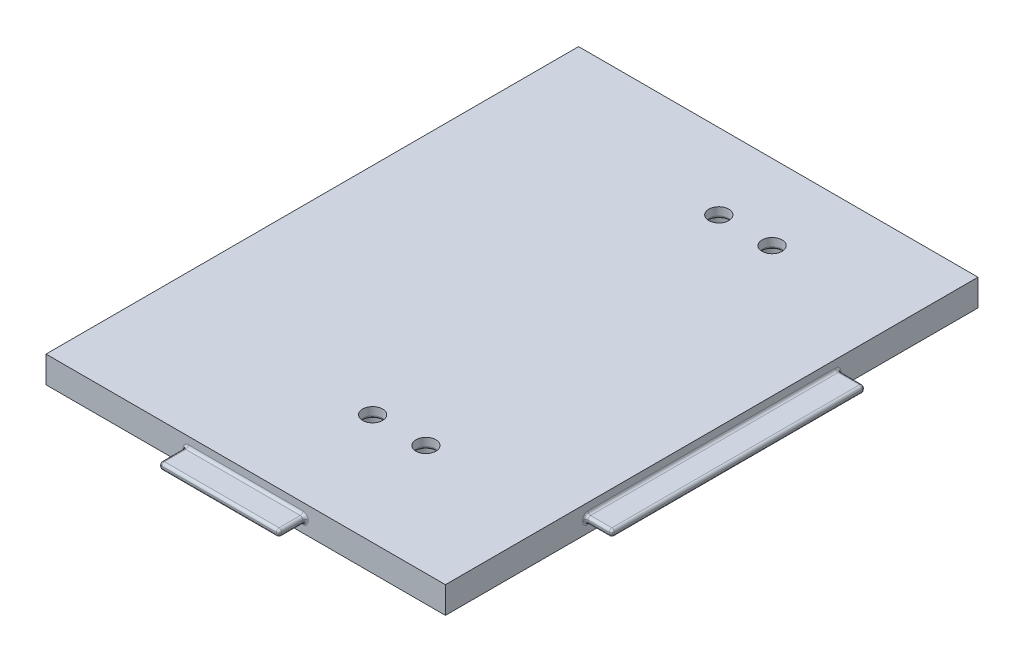
from build123d import *

# Parameters (mm, degrees)
SKETCH1_W           = 150
SKETCH1_H           = 200
BOSS_EXTRUDE1_DEPTH = 10
SKETCH2_W           = 100
SKETCH2_H           = 3
CUT_EXTRUDE1_DEPTH  = 10
CHAMFER1_SIZE       = 10
SKETCH3_W           = 50
SKETCH3_H           = 3
CUT_EXTRUDE2_DEPTH  = 10
CHAMFER2_SIZE       = 10
FILLET1_R           = 1
SKETCH4_W           = 45
SKETCH4_H           = 2.5
BOSS_EXTRUDE2_DEPTH = 10
SKETCH5_W           = 95
SKETCH5_H           = 2.5
BOSS_EXTRUDE3_DEPTH = 10
FILLET2_R           = 1
SKETCH6_R           = 3.75
CUT_EXTRUDE3_DEPTH  = 10
SKETCH7_R           = 5
CUT_EXTRUDE4_DEPTH  = 6
FILLET3_R           = 1


# Some blends are built 0.0001 mm under size
with BuildPart() as part:
    # Sketch1 → Boss-Extrude1 (new body)
    with BuildSketch(Plane(origin=(0, 0, 0), x_dir=(1, 0, 0), z_dir=(0, 1, 0))):
        Rectangle(SKETCH1_W, SKETCH1_H)
    extrude(amount=BOSS_EXTRUDE1_DEPTH)

    # Sketch2 → Cut-Extrude1 (cut)
    with BuildSketch(Plane.ZY.offset(75)):
        with Locations((0, 5)):
            Rectangle(SKETCH2_W, SKETCH2_H)
    extrude(amount=-CUT_EXTRUDE1_DEPTH, mode=Mode.SUBTRACT)

    # Chamfer1
    chamfer1_edges = [part.edges().sort_by_distance(p)[0] for p in [
        (-75, 5, 50),
        (-75, 5, -50),
    ]]
    chamfer(chamfer1_edges, length=CHAMFER1_SIZE - 0.0001)  # a hair under: the kernel refuses the full size

    # Sketch3 → Cut-Extrude2 (cut)
    with BuildSketch(Plane(origin=(0, 0, -100), x_dir=(-1, 0, 0), z_dir=(0, 0, -1))):
        with Locations((0, 5)):
            Rectangle(SKETCH3_W, SKETCH3_H)
    extrude(amount=-CUT_EXTRUDE2_DEPTH, mode=Mode.SUBTRACT)

    # Chamfer2
    chamfer2_edges = [part.edges().sort_by_distance(p)[0] for p in [
        (-25, 5, -100),
        (25, 5, -100),
    ]]
    chamfer(chamfer2_edges, length=CHAMFER2_SIZE - 0.0001)  # a hair under: the kernel refuses the full size

    # Fillet1
    # the kernel refuses this fillet: 1 mm, written as the material it adds along each edge
    with BuildSketch(Plane(origin=(-65, 6.5, 52.5), x_dir=(0, -1, 0), z_dir=(0, 0, -1)), Plane(origin=(-65, 3.5, -52.5), x_dir=(0, 1, 0), z_dir=(0, 0, 1))) as fillet1_piece_1:
        with BuildLine():
            CenterArc((FILLET1_R, FILLET1_R), FILLET1_R, 180, 90)
            Line((0, FILLET1_R), (0, 0))
            Line((0, 0), (FILLET1_R, 0))
        make_face()
    extrude(amount=105)
    with BuildSketch(Plane(origin=(-76.767766953, 6.5, 61.767666953), x_dir=(-0.7071067811865476, 0, -0.7071067811865476), z_dir=(0.7071067811865476, 0, -0.7071067811865476))) as fillet1_piece_2_section:
        with BuildLine():
            CenterArc((FILLET1_R, -FILLET1_R), FILLET1_R, 90, 90)
            Line((0, -FILLET1_R), (0, 0))
            Line((0, 0), (FILLET1_R, 0))
        make_face()
    fillet1_piece_2 = extrude(amount=19.141994202, mode=Mode.PRIVATE)
    fillet1_piece_2 = split(fillet1_piece_2, bisect_by=Plane(origin=(-75, 6.269593446, 54.844665919), z_dir=(1, 0, 0)), keep=Keep.TOP, mode=Mode.PRIVATE)
    add(fillet1_piece_2)
    with BuildSketch(Plane(origin=(-76.767766953, 3.5, 61.767666953), x_dir=(0, 1, 0), z_dir=(0.7071067811865476, 0, -0.7071067811865476))) as fillet1_piece_3_section:
        with BuildLine():
            CenterArc((FILLET1_R, -FILLET1_R), FILLET1_R, 90, 90)
            Line((0, -FILLET1_R), (0, 0))
            Line((0, 0), (FILLET1_R, 0))
        make_face()
    fillet1_piece_3 = extrude(amount=19.141994202, mode=Mode.PRIVATE)
    fillet1_piece_3 = split(fillet1_piece_3, bisect_by=Plane(origin=(-75, 3.730406554, 54.844665919), z_dir=(1, 0, 0)), keep=Keep.TOP, mode=Mode.PRIVATE)
    add(fillet1_piece_3)
    with BuildSketch(Plane(origin=(-76.767766953, 3.5, -61.767666953), x_dir=(0, 1, 0), z_dir=(0.7071067811865476, 0, 0.7071067811865476))) as fillet1_piece_4_section:
        with BuildLine():
            CenterArc((FILLET1_R, FILLET1_R), FILLET1_R, 180, 90)
            Line((0, FILLET1_R), (0, 0))
            Line((0, 0), (FILLET1_R, 0))
        make_face()
    fillet1_piece_4 = extrude(amount=19.141994202, mode=Mode.PRIVATE)
    fillet1_piece_4 = split(fillet1_piece_4, bisect_by=Plane(origin=(-75, 3.730406554, -54.844665919), z_dir=(1, 0, 0)), keep=Keep.TOP, mode=Mode.PRIVATE)
    add(fillet1_piece_4)
    with BuildSketch(Plane(origin=(-76.767766953, 6.5, -61.767666953), x_dir=(0, -1, 0), z_dir=(0.7071067811865476, 0, 0.7071067811865476))) as fillet1_piece_5_section:
        with BuildLine():
            CenterArc((FILLET1_R, -FILLET1_R), FILLET1_R, 90, 90)
            Line((0, -FILLET1_R), (0, 0))
            Line((0, 0), (FILLET1_R, 0))
        make_face()
    fillet1_piece_5 = extrude(amount=19.141994202, mode=Mode.PRIVATE)
    fillet1_piece_5 = split(fillet1_piece_5, bisect_by=Plane(origin=(-75, 6.269593446, -54.844665919), z_dir=(1, 0, 0)), keep=Keep.TOP, mode=Mode.PRIVATE)
    add(fillet1_piece_5)
    with BuildSketch(Plane(origin=(-27.5, 6.5, -90), x_dir=(0, -1, 0), z_dir=(1, 0, 0)), Plane(origin=(27.5, 3.5, -90), x_dir=(0, 1, 0), z_dir=(-1, 0, 0))) as fillet1_piece_6:
        with BuildLine():
            CenterArc((FILLET1_R, FILLET1_R), FILLET1_R, 180, 90)
            Line((0, FILLET1_R), (0, 0))
            Line((0, 0), (FILLET1_R, 0))
        make_face()
    extrude(amount=55)
    with BuildSketch(Plane(origin=(-36.767666953, 6.5, -101.767766953), x_dir=(0.7071067811865475, 0, -0.7071067811865477), z_dir=(0.7071067811865477, 0, 0.7071067811865474))) as fillet1_piece_7_section:
        with BuildLine():
            CenterArc((FILLET1_R, -FILLET1_R), FILLET1_R, 90, 90)
            Line((0, -FILLET1_R), (0, 0))
            Line((0, 0), (FILLET1_R, 0))
        make_face()
    fillet1_piece_7 = extrude(amount=19.141994202, mode=Mode.PRIVATE)
    fillet1_piece_7 = split(fillet1_piece_7, bisect_by=Plane(origin=(-29.844665919, 6.269593446, -100), z_dir=(0, 0, 1)), keep=Keep.TOP, mode=Mode.PRIVATE)
    add(fillet1_piece_7)
    with BuildSketch(Plane(origin=(-36.767666953, 3.5, -101.767766953), x_dir=(0, 1, 0), z_dir=(0.7071067811865477, 0, 0.7071067811865474))) as fillet1_piece_8_section:
        with BuildLine():
            CenterArc((FILLET1_R, -FILLET1_R), FILLET1_R, 90, 90)
            Line((0, -FILLET1_R), (0, 0))
            Line((0, 0), (FILLET1_R, 0))
        make_face()
    fillet1_piece_8 = extrude(amount=19.141994202, mode=Mode.PRIVATE)
    fillet1_piece_8 = split(fillet1_piece_8, bisect_by=Plane(origin=(-29.844665919, 3.730406554, -100), z_dir=(0, 0, 1)), keep=Keep.TOP, mode=Mode.PRIVATE)
    add(fillet1_piece_8)
    with BuildSketch(Plane(origin=(36.767666953, 3.5, -101.767766953), x_dir=(0, 1, 0), z_dir=(-0.7071067811865474, 0, 0.7071067811865477))) as fillet1_piece_9_section:
        with BuildLine():
            CenterArc((FILLET1_R, FILLET1_R), FILLET1_R, 180, 90)
            Line((0, FILLET1_R), (0, 0))
            Line((0, 0), (FILLET1_R, 0))
        make_face()
    fillet1_piece_9 = extrude(amount=19.141994202, mode=Mode.PRIVATE)
    fillet1_piece_9 = split(fillet1_piece_9, bisect_by=Plane(origin=(29.844665919, 3.730406554, -100), z_dir=(0, 0, 1)), keep=Keep.TOP, mode=Mode.PRIVATE)
    add(fillet1_piece_9)
    with BuildSketch(Plane(origin=(36.767666953, 6.5, -101.767766953), x_dir=(0, -1, 0), z_dir=(-0.7071067811865474, 0, 0.7071067811865477))) as fillet1_piece_10_section:
        with BuildLine():
            CenterArc((FILLET1_R, -FILLET1_R), FILLET1_R, 90, 90)
            Line((0, -FILLET1_R), (0, 0))
            Line((0, 0), (FILLET1_R, 0))
        make_face()
    fillet1_piece_10 = extrude(amount=19.141994202, mode=Mode.PRIVATE)
    fillet1_piece_10 = split(fillet1_piece_10, bisect_by=Plane(origin=(29.844665919, 6.269593446, -100), z_dir=(0, 0, 1)), keep=Keep.TOP, mode=Mode.PRIVATE)
    add(fillet1_piece_10)

    # Sketch4 → Boss-Extrude2 (add)
    with BuildSketch(Plane.XY.offset(100)):
        with Locations((0, 5)):
            Rectangle(SKETCH4_W, SKETCH4_H)
    extrude(amount=BOSS_EXTRUDE2_DEPTH)

    # Sketch5 → Boss-Extrude3 (add)
    with BuildSketch(Plane(origin=(75, 0, 0), x_dir=(0, 0, -1), z_dir=(1, 0, 0))):
        with Locations((0, 5)):
            Rectangle(SKETCH5_W, SKETCH5_H)
    extrude(amount=BOSS_EXTRUDE3_DEPTH)

    # Fillet2
    fillet2_edges = [part.edges().sort_by_distance(p)[0] for p in [
        (-22.5, 5, 100),
        (-22.5, 6.25, 105),
        (0, 3.75, 100),
        (-22.5, 3.75, 105),
        (22.5, 5, 100),
        (22.5, 3.75, 105),
        (0, 6.25, 100),
        (22.5, 6.25, 105),
        (-22.5, 5, 110),
        (0, 3.75, 110),
        (22.5, 5, 110),
        (0, 6.25, 110),
        (75, 5, 47.5),
        (80, 6.25, 47.5),
        (75, 3.75, 0),
        (80, 3.75, 47.5),
        (75, 5, -47.5),
        (80, 3.75, -47.5),
        (75, 6.25, 0),
        (80, 6.25, -47.5),
        (85, 5, 47.5),
        (85, 3.75, 0),
        (85, 5, -47.5),
        (85, 6.25, 0),
    ]]
    fillet(fillet2_edges, radius=FILLET2_R)

    # Sketch6 → Cut-Extrude3 (cut)
    with BuildSketch(Plane(origin=(0, 10, 0), x_dir=(1, 0, 0), z_dir=(0, 1, 0))):
        with Locations(Location((26.062, 71.599, 0), (0, 0, 270))):
            Circle(SKETCH6_R)
        with Locations(Location((26.062, -58.401, 0), (0, 0, 270))):
            Circle(SKETCH6_R)
        with Locations(Location((6.06, 71.599, 0), (0, 0, 270))):
            Circle(SKETCH6_R)
        with Locations(Location((6.06, -58.401, 0), (0, 0, 270))):
            Circle(SKETCH6_R)
    extrude(amount=-CUT_EXTRUDE3_DEPTH, mode=Mode.SUBTRACT)

    # Sketch7 → Cut-Extrude4 (cut)
    with BuildSketch(Plane.XZ):
        with Locations(Location((6.06, -71.599, 0), (0, 0, 270))):
            Circle(SKETCH7_R)
        with Locations(Location((26.062, -71.599, 0), (0, 0, 270))):
            Circle(SKETCH7_R)
        with Locations(Location((26.062, 58.401, 0), (0, 0, 270))):
            Circle(SKETCH7_R)
        with Locations(Location((6.06, 58.401, 0), (0, 0, 270))):
            Circle(SKETCH7_R)
    extrude(amount=-CUT_EXTRUDE4_DEPTH, mode=Mode.SUBTRACT)

    # Fillet3
    fillet3_edges = [part.edges().sort_by_distance(p)[0] for p in [
        (6.06, 0, 63.401),
        (6.06, 6, 54.651),
        (26.062, 0, 63.401),
        (26.062, 6, 54.651),
        (26.062, 0, -66.599),
        (26.062, 6, -75.349),
        (6.06, 0, -66.599),
        (6.06, 6, -75.349),
    ]]
    fillet(fillet3_edges, radius=FILLET3_R)


solid = part.part
